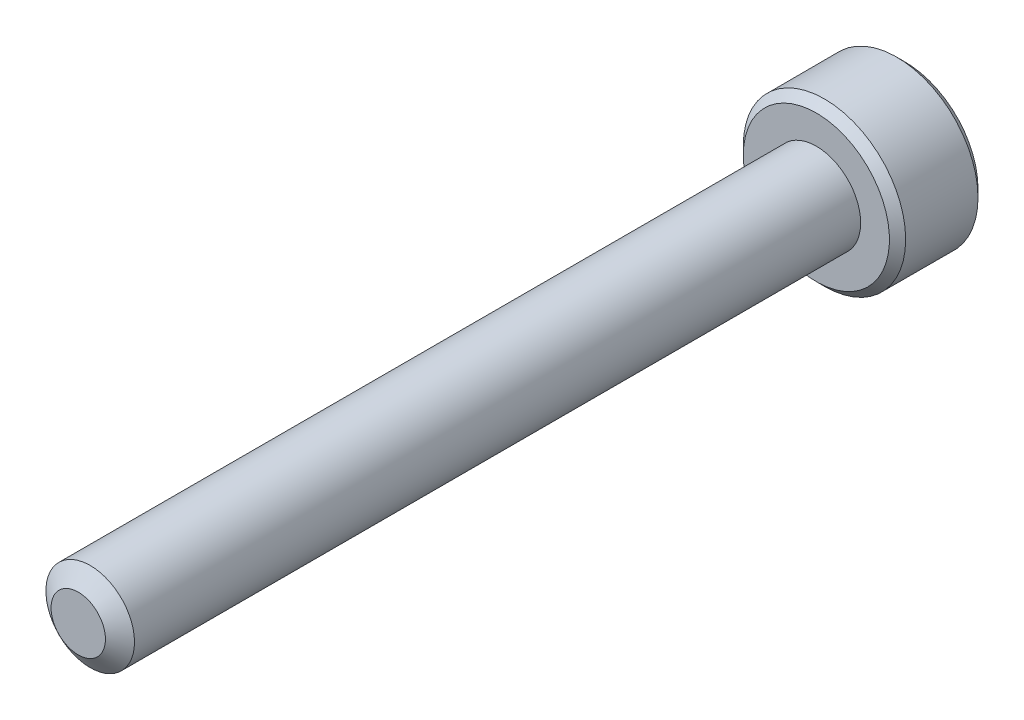
from build123d import *

# Parameters (mm, degrees)
SKETCH1_R          = 1.5
EXTRUDE1_DEPTH     = 25
SKETCH6_R          = 2.75
EXTRUDE2_DEPTH     = 3
CUT_EXTRUDE1_DEPTH = 1.875
CHAMFER1_SIZE      = 0.275


with BuildPart() as part:
    # Sketch1 → Extrude1 (new body)
    with BuildSketch(Plane.XY):
        Circle(SKETCH1_R)
    extrude(amount=-EXTRUDE1_DEPTH)

    # Sketch4 → Cut-Revolve1 (revolve, cut)
    with BuildSketch(Plane(origin=(0, 0, 0), x_dir=(0, 0, -1), z_dir=(1, 0, 0))):
        Polygon((0.405251783, 1.5), (0, 0.921240474), (0, 1.5), align=None)
    revolve(axis=Axis((0, 0, 0), (0, 0, -1)), mode=Mode.SUBTRACT)

    # Sketch6 → Extrude2 (add)
    with BuildSketch(Plane(origin=(0, 0, -25), x_dir=(-1, 0, 0), z_dir=(0, 0, -1))):
        Circle(SKETCH6_R)
    extrude(amount=EXTRUDE2_DEPTH)

    # Sketch7 → Cut-Extrude1 (cut)
    with BuildSketch(Plane(origin=(0, 0, -28), x_dir=(-1, 0, 0), z_dir=(0, 0, -1))):
        Polygon((0, 1.443375673), (-1.25, 0.721687836), (-1.25, -0.721687836), (0, -1.443375673), (1.25, -0.721687836), (1.25, 0.721687836), align=None)
    extrude(amount=-CUT_EXTRUDE1_DEPTH, mode=Mode.SUBTRACT)

    # Cut-Extrude2 cone 1 section (through the dimple's axis) → Cut-Extrude2 (revolve, cut)
    with BuildSketch(Plane(origin=(0, 0, -28), x_dir=(0, 1, 0), z_dir=(1, 0, 0))):
        Polygon((0, 0), (1.443375673, 0), (0, 1.443375673), align=None)
    revolve(axis=Axis((0, 0, -28), (0, 0, 1)), mode=Mode.SUBTRACT)

    # Chamfer1
    chamfer1_edges = [part.edges().sort_by_distance(p)[0] for p in [
        (2.75, 0, -28),
        (2.75, 0, -25),
    ]]
    chamfer(chamfer1_edges, length=CHAMFER1_SIZE)


solid = part.part
